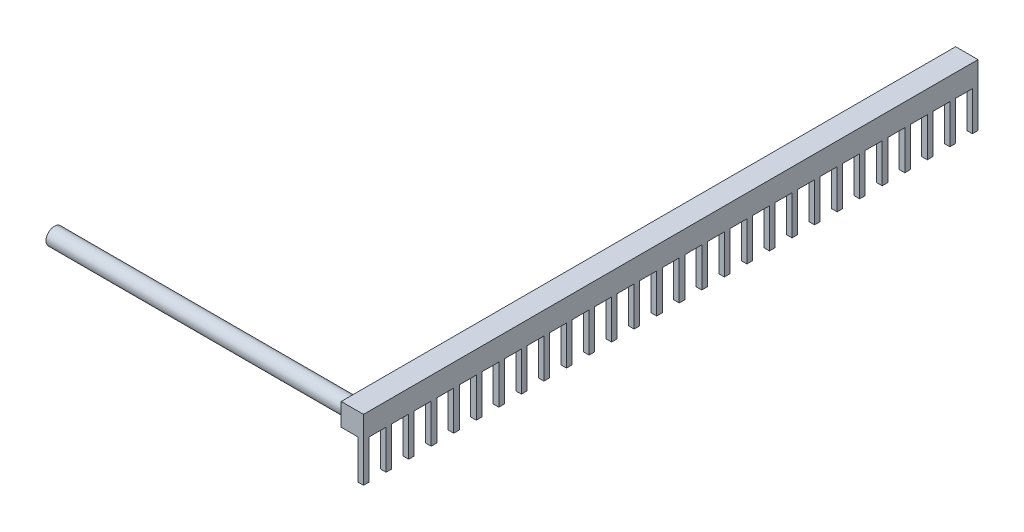
from build123d import *

# Parameters (mm, degrees)
SKETCH1_W           = 20
SKETCH1_H           = 20
BOSS_EXTRUDE1_DEPTH = 550
SKETCH2_R           = 7.5
BOSS_EXTRUDE2_DEPTH = 266.7
SKETCH3_W           = 5
SKETCH3_H           = 35
BOSS_EXTRUDE3_DEPTH = 5
LPATTERN1_COUNT     = 28
LPATTERN1_PITCH     = 20.1852


with BuildPart() as part:
    # Sketch1 → Boss-Extrude1 (new body)
    with BuildSketch(Plane.XY):
        with Locations((-10, 10)):
            Rectangle(SKETCH1_W, SKETCH1_H)
    extrude(amount=BOSS_EXTRUDE1_DEPTH)

    # Sketch2 → Boss-Extrude2 (add)
    with BuildSketch(Plane.ZY.offset(20)):
        with Locations((540, 10)):
            Circle(SKETCH2_R)
    extrude(amount=BOSS_EXTRUDE2_DEPTH)

    # Sketch3 → Boss-Extrude3 (add)
    with BuildSketch(Plane.XY.offset(550)):
        with Locations((-2.5, -17.5)):
            Rectangle(SKETCH3_W, SKETCH3_H)
    boss_extrude3 = extrude(amount=-BOSS_EXTRUDE3_DEPTH)

    # LPattern1: Boss-Extrude3 ×28
    with Locations(*[(0, 0, -i * LPATTERN1_PITCH) for i in range(1, LPATTERN1_COUNT)]):
        add(boss_extrude3)


solid = part.part
